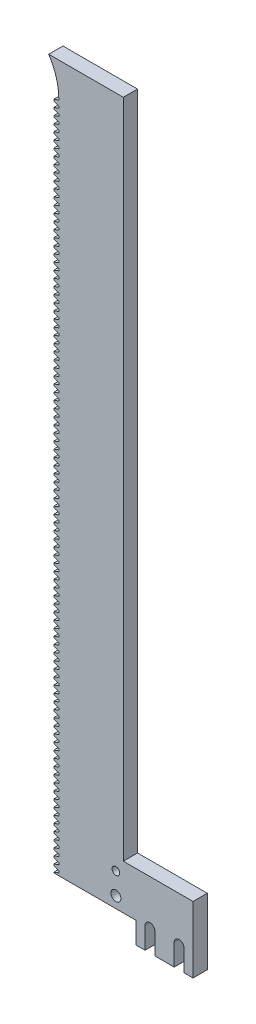
from build123d import *

# Parameters (mm, degrees)
BOSS_EXTRUDE2_DEPTH = 3.175
BOSS_EXTRUDE3_DEPTH = 3.175
SKETCH3_W           = 15.55
SKETCH3_H           = 10
BOSS_EXTRUDE4_DEPTH = 3.175
SKETCH4_R           = 1.125
SKETCH4_R_2         = 0.85
CUT_EXTRUDE1_DEPTH  = 9.58578644
SKETCH5_W           = 12.7
SKETCH5_H           = 4.77898178
BOSS_EXTRUDE5_DEPTH = 3.175
CUT_EXTRUDE2_DEPTH  = 3.175


with BuildPart() as part:
    # Sketch1 → Boss-Extrude2 (new body)
    with BuildSketch(Plane.XY):
        Polygon((-9.5, -73.286538748), (-9.5, -73.593966677), (-8.375, -74.00343319), (-8.375, -74.44786856), (-9.5, -74.857335073), (-9.5, -75), (6, -75), (6, 75), (-8.375, 75), (-8.375, 74.777782315), (-9.5, 74.368315802), (-9.5, 74.060887873), (-8.375, 73.65142136), (-8.375, 73.20698599), (-9.5, 72.797519477), (-9.5, 72.490091548), (-8.375, 72.080625035), (-8.375, 71.636189665), (-9.5, 71.226723152), (-9.5, 70.919295223), (-8.375, 70.50982871), (-8.375, 70.06539334), (-9.5, 69.655926827), (-9.5, 69.348498898), (-8.375, 68.939032385), (-8.375, 68.494597015), (-9.5, 68.085130502), (-9.5, 67.777702573), (-8.375, 67.36823606), (-8.375, 66.92380069), (-9.5, 66.514334177), (-9.5, 66.206906248), (-8.375, 65.797439735), (-8.375, 65.353004365), (-9.5, 64.943537852), (-9.5, 64.636109923), (-8.375, 64.22664341), (-8.375, 63.78220804), (-9.5, 63.372741527), (-9.5, 63.065313598), (-8.375, 62.655847085), (-8.375, 62.211411715), (-9.5, 61.801945202), (-9.5, 61.494517273), (-8.375, 61.08505076), (-8.375, 60.64061539), (-9.5, 60.231148877), (-9.5, 59.923720948), (-8.375, 59.514254435), (-8.375, 59.069819065), (-9.5, 58.660352552), (-9.5, 58.352924623), (-8.375, 57.94345811), (-8.375, 57.49902274), (-9.5, 57.089556227), (-9.5, 56.782128298), (-8.375, 56.372661785), (-8.375, 55.928226415), (-9.5, 55.518759902), (-9.5, 55.211331973), (-8.375, 54.80186546), (-8.375, 54.35743009), (-9.5, 53.947963577), (-9.5, 53.640535648), (-8.375, 53.231069135), (-8.375, 52.786633765), (-9.5, 52.377167252), (-9.5, 52.069739323), (-8.375, 51.66027281), (-8.375, 51.21583744), (-9.5, 50.806370927), (-9.5, 50.498942998), (-8.375, 50.089476485), (-8.375, 49.645041115), (-9.5, 49.235574602), (-9.5, 48.928146673), (-8.375, 48.51868016), (-8.375, 48.07424479), (-9.5, 47.664778277), (-9.5, 47.357350348), (-8.375, 46.947883835), (-8.375, 46.503448465), (-9.5, 46.093981952), (-9.5, 45.786554023), (-8.375, 45.37708751), (-8.375, 44.93265214), (-9.5, 44.523185627), (-9.5, 44.215757698), (-8.375, 43.806291185), (-8.375, 43.361855815), (-9.5, 42.952389302), (-9.5, 42.644961373), (-8.375, 42.23549486), (-8.375, 41.79105949), (-9.5, 41.381592977), (-9.5, 41.074165048), (-8.375, 40.664698535), (-8.375, 40.220263165), (-9.5, 39.810796652), (-9.5, 39.503368723), (-8.375, 39.09390221), (-8.375, 38.64946684), (-9.5, 38.240000327), (-9.5, 37.932572398), (-8.375, 37.523105885), (-8.375, 37.078670515), (-9.5, 36.669204002), (-9.5, 36.361776073), (-8.375, 35.95230956), (-8.375, 35.50787419), (-9.5, 35.098407677), (-9.5, 34.790979748), (-8.375, 34.381513235), (-8.375, 33.937077865), (-9.5, 33.527611352), (-9.5, 33.220183423), (-8.375, 32.81071691), (-8.375, 32.36628154), (-9.5, 31.956815027), (-9.5, 31.649387098), (-8.375, 31.239920585), (-8.375, 30.795485215), (-9.5, 30.386018702), (-9.5, 30.078590773), (-8.375, 29.66912426), (-8.375, 29.22468889), (-9.5, 28.815222377), (-9.5, 28.507794448), (-8.375, 28.098327935), (-8.375, 27.653892565), (-9.5, 27.244426052), (-9.5, 26.936998123), (-8.375, 26.52753161), (-8.375, 26.08309624), (-9.5, 25.673629727), (-9.5, 25.366201798), (-8.375, 24.956735285), (-8.375, 24.512299915), (-9.5, 24.102833402), (-9.5, 23.795405473), (-8.375, 23.38593896), (-8.375, 22.94150359), (-9.5, 22.532037077), (-9.5, 22.224609148), (-8.375, 21.815142635), (-8.375, 21.370707265), (-9.5, 20.961240752), (-9.5, 20.653812823), (-8.375, 20.24434631), (-8.375, 19.79991094), (-9.5, 19.390444427), (-9.5, 19.083016498), (-8.375, 18.673549985), (-8.375, 18.229114615), (-9.5, 17.819648102), (-9.5, 17.512220173), (-8.375, 17.10275366), (-8.375, 16.65831829), (-9.5, 16.248851777), (-9.5, 15.941423848), (-8.375, 15.531957335), (-8.375, 15.087521965), (-9.5, 14.678055452), (-9.5, 14.370627523), (-8.375, 13.96116101), (-8.375, 13.51672564), (-9.5, 13.107259127), (-9.5, 12.799831198), (-8.375, 12.390364685), (-8.375, 11.945929315), (-9.5, 11.536462802), (-9.5, 11.229034873), (-8.375, 10.81956836), (-8.375, 10.37513299), (-9.5, 9.965666477), (-9.5, 9.658238548), (-8.375, 9.248772035), (-8.375, 8.804336665), (-9.5, 8.394870152), (-9.5, 8.087442223), (-8.375, 7.67797571), (-8.375, 7.23354034), (-9.5, 6.824073827), (-9.5, 6.516645898), (-8.375, 6.107179385), (-8.375, 5.662744015), (-9.5, 5.253277502), (-9.5, 4.945849573), (-8.375, 4.53638306), (-8.375, 4.09194769), (-9.5, 3.682481177), (-9.5, 3.375053248), (-8.375, 2.965586735), (-8.375, 2.521151365), (-9.5, 2.111684852), (-9.5, 1.804256923), (-8.375, 1.39479041), (-8.375, 0.95035504), (-9.5, 0.540888527), (-9.5, 0.233460598), (-8.375, -0.176005915), (-8.375, -0.620441285), (-9.5, -1.029907798), (-9.5, -1.337335727), (-8.375, -1.74680224), (-8.375, -2.19123761), (-9.5, -2.600704123), (-9.5, -2.908132052), (-8.375, -3.317598565), (-8.375, -3.762033935), (-9.5, -4.171500448), (-9.5, -4.478928377), (-8.375, -4.88839489), (-8.375, -5.33283026), (-9.5, -5.742296773), (-9.5, -6.049724702), (-8.375, -6.459191215), (-8.375, -6.903626585), (-9.5, -7.313093098), (-9.5, -7.620521027), (-8.375, -8.02998754), (-8.375, -8.47442291), (-9.5, -8.883889423), (-9.5, -9.191317352), (-8.375, -9.600783865), (-8.375, -10.045219235), (-9.5, -10.454685748), (-9.5, -10.762113677), (-8.375, -11.17158019), (-8.375, -11.61601556), (-9.5, -12.025482073), (-9.5, -12.332910002), (-8.375, -12.742376515), (-8.375, -13.186811885), (-9.5, -13.596278398), (-9.5, -13.903706327), (-8.375, -14.31317284), (-8.375, -14.75760821), (-9.5, -15.167074723), (-9.5, -15.474502652), (-8.375, -15.883969165), (-8.375, -16.328404535), (-9.5, -16.737871048), (-9.5, -17.045298977), (-8.375, -17.45476549), (-8.375, -17.89920086), (-9.5, -18.308667373), (-9.5, -18.616095302), (-8.375, -19.025561815), (-8.375, -19.469997185), (-9.5, -19.879463698), (-9.5, -20.186891627), (-8.375, -20.59635814), (-8.375, -21.04079351), (-9.5, -21.450260023), (-9.5, -21.757687952), (-8.375, -22.167154465), (-8.375, -22.611589835), (-9.5, -23.021056348), (-9.5, -23.328484277), (-8.375, -23.73795079), (-8.375, -24.18238616), (-9.5, -24.591852673), (-9.5, -24.899280602), (-8.375, -25.308747115), (-8.375, -25.753182485), (-9.5, -26.162648998), (-9.5, -26.470076927), (-8.375, -26.87954344), (-8.375, -27.32397881), (-9.5, -27.733445323), (-9.5, -28.040873252), (-8.375, -28.450339765), (-8.375, -28.894775135), (-9.5, -29.304241648), (-9.5, -29.611669577), (-8.375, -30.02113609), (-8.375, -30.46557146), (-9.5, -30.875037973), (-9.5, -31.182465902), (-8.375, -31.591932415), (-8.375, -32.036367785), (-9.5, -32.445834298), (-9.5, -32.753262227), (-8.375, -33.16272874), (-8.375, -33.60716411), (-9.5, -34.016630623), (-9.5, -34.324058552), (-8.375, -34.733525065), (-8.375, -35.177960435), (-9.5, -35.587426948), (-9.5, -35.894854877), (-8.375, -36.30432139), (-8.375, -36.74875676), (-9.5, -37.158223273), (-9.5, -37.465651202), (-8.375, -37.875117715), (-8.375, -38.319553085), (-9.5, -38.729019598), (-9.5, -39.036447527), (-8.375, -39.44591404), (-8.375, -39.89034941), (-9.5, -40.299815923), (-9.5, -40.607243852), (-8.375, -41.016710365), (-8.375, -41.461145735), (-9.5, -41.870612248), (-9.5, -42.178040177), (-8.375, -42.58750669), (-8.375, -43.03194206), (-9.5, -43.441408573), (-9.5, -43.748836502), (-8.375, -44.158303015), (-8.375, -44.602738385), (-9.5, -45.012204898), (-9.5, -45.319632827), (-8.375, -45.72909934), (-8.375, -46.17353471), (-9.5, -46.583001223), (-9.5, -46.890429152), (-8.375, -47.299895665), (-8.375, -47.744331035), (-9.5, -48.153797548), (-9.5, -48.461225477), (-8.375, -48.87069199), (-8.375, -49.31512736), (-9.5, -49.724593873), (-9.5, -50.032021802), (-8.375, -50.441488315), (-8.375, -50.885923685), (-9.5, -51.295390198), (-9.5, -51.602818127), (-8.375, -52.01228464), (-8.375, -52.45672001), (-9.5, -52.866186523), (-9.5, -53.173614452), (-8.375, -53.583080965), (-8.375, -54.027516335), (-9.5, -54.436982848), (-9.5, -54.744410777), (-8.375, -55.15387729), (-8.375, -55.59831266), (-9.5, -56.007779173), (-9.5, -56.315207102), (-8.375, -56.724673615), (-8.375, -57.169108985), (-9.5, -57.578575498), (-9.5, -57.886003427), (-8.375, -58.29546994), (-8.375, -58.73990531), (-9.5, -59.149371823), (-9.5, -59.456799752), (-8.375, -59.866266265), (-8.375, -60.310701635), (-9.5, -60.720168148), (-9.5, -61.027596077), (-8.375, -61.43706259), (-8.375, -61.88149796), (-9.5, -62.290964473), (-9.5, -62.598392402), (-8.375, -63.007858915), (-8.375, -63.452294285), (-9.5, -63.861760798), (-9.5, -64.169188727), (-8.375, -64.57865524), (-8.375, -65.02309061), (-9.5, -65.432557123), (-9.5, -65.739985052), (-8.375, -66.149451565), (-8.375, -66.593886935), (-9.5, -67.003353448), (-9.5, -67.310781377), (-8.375, -67.72024789), (-8.375, -68.16468326), (-9.5, -68.574149773), (-9.5, -68.881577702), (-8.375, -69.291044215), (-8.375, -69.735479585), (-9.5, -70.144946098), (-9.5, -70.452374027), (-8.375, -70.86184054), (-8.375, -71.30627591), (-9.5, -71.715742423), (-9.5, -72.023170352), (-8.375, -72.432636865), (-8.375, -72.877072235), align=None)
    extrude(amount=BOSS_EXTRUDE2_DEPTH)

    # Sketch2 → Boss-Extrude3 (add)
    with BuildSketch(Plane.XY.offset(3.175)):
        with BuildLine():
            Line((6, 82.5), (-10.630961085, 82.5))
            ThreePointArc((-10.630961085, 82.5), (-8.951200965, 78.915972434), (-8.375, 75))
            Line((-8.375, 75), (6, 75))
            Line((6, 75), (6, 82.5))
        make_face()
    extrude(amount=-BOSS_EXTRUDE3_DEPTH)

    # Sketch3 → Boss-Extrude4 (add)
    with BuildSketch(Plane.XY.offset(3.175)):
        with Locations((13.775, -70)):
            Rectangle(SKETCH3_W, SKETCH3_H)
    extrude(amount=-BOSS_EXTRUDE4_DEPTH)

    # Sketch4 → Cut-Extrude1 (cut)
    with BuildSketch(Plane.XY.offset(3.175)):
        with Locations((4.35, -72.5)):
            Circle(SKETCH4_R)
        with Locations((4.35, -67.71)):
            Circle(SKETCH4_R_2)
    extrude(amount=-CUT_EXTRUDE1_DEPTH, mode=Mode.SUBTRACT)

    # Sketch5 → Boss-Extrude5 (add)
    with BuildSketch(Plane.XY.offset(3.175)):
        with Locations((15.2, -77.38949089)):
            Rectangle(SKETCH5_W, SKETCH5_H)
    extrude(amount=-BOSS_EXTRUDE5_DEPTH)

    # Sketch6 → Cut-Extrude2 (cut)
    with BuildSketch(Plane.XY.offset(3.175)):
        with BuildLine():
            Line((10.85, -75), (10.85, -79.77898178))
            Line((10.85, -79.77898178), (13.05, -79.77898178))
            Line((13.05, -79.77898178), (13.05, -75))
            ThreePointArc((13.05, -75), (11.95, -73.9), (10.85, -75))
        make_face()
        with BuildLine():
            Line((17.35, -75), (17.35, -79.77898178))
            Line((17.35, -79.77898178), (19.55, -79.77898178))
            Line((19.55, -79.77898178), (19.55, -75))
            ThreePointArc((19.55, -75), (18.45, -73.9), (17.35, -75))
        make_face()
    extrude(amount=-CUT_EXTRUDE2_DEPTH, mode=Mode.SUBTRACT)


solid = part.part
